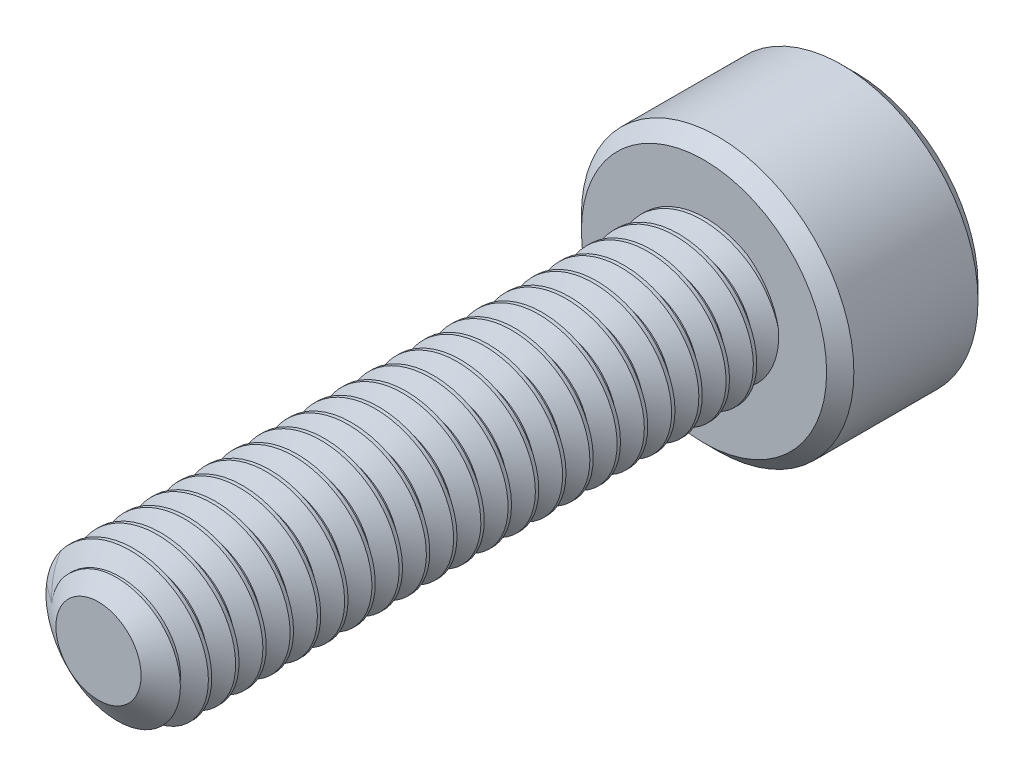
from build123d import *

# Parameters (mm, degrees)
SKETCH1_R          = 1.25
EXTRUDE1_DEPTH     = 10
CUT_SWEEP1_PITCH   = 0.45
SKETCH6_R          = 2.25
EXTRUDE2_DEPTH     = 2.5
CUT_EXTRUDE1_DEPTH = 1.5
CHAMFER1_SIZE      = 0.225


with BuildPart() as part:
    # Sketch1 → Extrude1 (new body)
    with BuildSketch(Plane.XY):
        Circle(SKETCH1_R)
    extrude(amount=-EXTRUDE1_DEPTH)

    # Cut-Sweep1: the profile of Sketch3 profile screwed along a right-hand helix of 23.222222 turns, 6 arcs to a turn; built about Z, then put on its axis
    cut_sweep1_z = Axis((0, 0, 0), (0, 0, 1))
    cut_sweep1_corners = [(1.2503, 0, -0.393923205), (0.957716426, 0, -0.225), (0.957716426, 0, -0.16875), (1.2503, 0, 0.000173205)]
    with BuildLine(mode=Mode.PRIVATE) as cut_sweep1_profile:
        Line(cut_sweep1_corners[0], cut_sweep1_corners[1])
        Line(cut_sweep1_corners[1], cut_sweep1_corners[2])
        Line(cut_sweep1_corners[2], cut_sweep1_corners[3])
        Line(cut_sweep1_corners[3], cut_sweep1_corners[0])
    cut_sweep1_cap = Face(cut_sweep1_profile.wire())
    cut_sweep1_turn_angles = [0, 30, 60, 90, 120, 150, 180, 210, 240, 270, 300, 330, 360]
    cut_sweep1_turn_weights = [1, 0.8660254037844387, 1, 0.8660254037844387, 1, 0.8660254037844387, 1, 0.8660254037844387, 1, 0.8660254037844387, 1, 0.8660254037844387, 1]
    cut_sweep1_turn_rails = [Edge.make_bspline([Vector(p[0], p[1], 0).rotate(cut_sweep1_z, cut_sweep1_turn_angles[k]) / cut_sweep1_turn_weights[k] + Vector(0, 0, p[2] + CUT_SWEEP1_PITCH * cut_sweep1_turn_angles[k] / 360) for k in range(13)], [0, 0, 0, 1, 1, 2, 2, 3, 3, 4, 4, 5, 5, 6, 6, 6], 2, cut_sweep1_turn_weights) for p in cut_sweep1_corners]
    cut_sweep1_turn_sides = [Face.make_surface_from_curves(cut_sweep1_turn_rails[p[0]], cut_sweep1_turn_rails[p[1]]) for p in [(0, 1), (1, 2), (2, 3), (3, 0)]]
    cut_sweep1_last_angles = [8280, 8310, 8340, 8350, 8360]
    cut_sweep1_last_weights = [1, 0.8660254037844387, 1, 0.9848077530121667, 1]
    cut_sweep1_last_rails = [Edge.make_bspline([Vector(p[0], p[1], 0).rotate(cut_sweep1_z, cut_sweep1_last_angles[k]) / cut_sweep1_last_weights[k] + Vector(0, 0, p[2] + CUT_SWEEP1_PITCH * cut_sweep1_last_angles[k] / 360) for k in range(5)], [0, 0, 0, 1, 1, 2, 2, 2], 2, cut_sweep1_last_weights) for p in cut_sweep1_corners]
    cut_sweep1_last_sides = [Face.make_surface_from_curves(cut_sweep1_last_rails[p[0]], cut_sweep1_last_rails[p[1]]) for p in [(0, 1), (1, 2), (2, 3), (3, 0)]]
    cut_sweep1 = Plane(origin=(0, 0, 0), x_dir=(0, 1, 0), z_dir=(0, 0, -1)) * Solid(Shell([*[p.moved(Location((0, 0, CUT_SWEEP1_PITCH * i))) for i in range(23) for p in cut_sweep1_turn_sides], *cut_sweep1_last_sides, cut_sweep1_cap, cut_sweep1_cap.rotate(cut_sweep1_z, 8360).moved(Location((0, 0, CUT_SWEEP1_PITCH * 8360 / 360)))]))
    add(cut_sweep1, mode=Mode.SUBTRACT)

    # Sketch4 → Cut-Revolve1 (revolve, cut)
    with BuildSketch(Plane(origin=(0, 0, 0), x_dir=(0, 0, -1), z_dir=(1, 0, 0)), mode=Mode.PRIVATE) as cut_revolve1_sk:
        Polygon((0.382511876, 1.25), (0, 0.703716426), (0, 1.25), align=None)
    revolve(cut_revolve1_sk.sketch.rotate(Axis((0, 0, 0), (0, 0, -1)), 276.971148597), axis=Axis((0, 0, 0), (0, 0, -1)), mode=Mode.SUBTRACT)

    # Sketch6 → Extrude2 (add)
    with BuildSketch(Plane(origin=(0, 0, -10), x_dir=(-1, 0, 0), z_dir=(0, 0, -1))):
        Circle(SKETCH6_R)
    extrude(amount=EXTRUDE2_DEPTH)

    # Sketch7 → Cut-Extrude1 (cut)
    with BuildSketch(Plane(origin=(0, 0, -12.5), x_dir=(-1, 0, 0), z_dir=(0, 0, -1))):
        Polygon((0, 1.154700538), (-1, 0.577350269), (-1, -0.577350269), (0, -1.154700538), (1, -0.577350269), (1, 0.577350269), align=None)
    extrude(amount=-CUT_EXTRUDE1_DEPTH, mode=Mode.SUBTRACT)

    # Cut-Extrude2 cone 1 section (through the dimple's axis) → Cut-Extrude2 (revolve, cut)
    with BuildSketch(Plane(origin=(0, 0, -12.5), x_dir=(0, 1, 0), z_dir=(1, 0, 0))):
        Polygon((0, 0), (1.154700538, 0), (0, 1.154700538), align=None)
    revolve(axis=Axis((0, 0, -12.5), (0, 0, 1)), mode=Mode.SUBTRACT)

    # Chamfer1
    chamfer1_edges = [part.edges().sort_by_distance(p)[0] for p in [
        (2.25, 0, -10),
        (2.25, 0, -12.5),
    ]]
    chamfer(chamfer1_edges, length=CHAMFER1_SIZE)


solid = part.part
